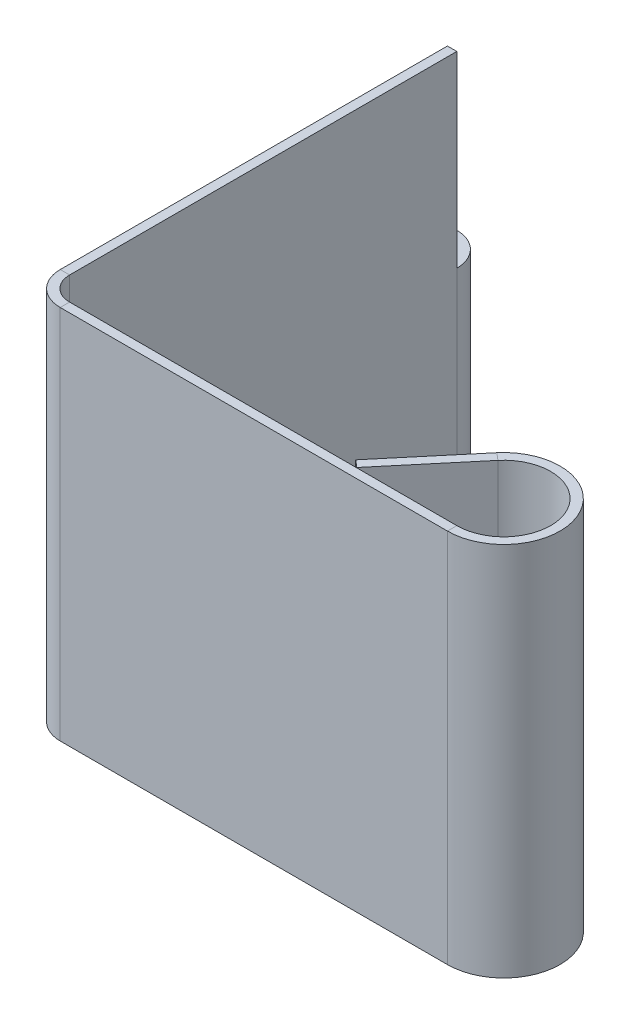
from build123d import *

# Parameters (mm, degrees)
BASE_FLANGE3_DEPTH = 160
EDGE_FLANGE4_DEPTH = 80
HEM1_DEPTH         = 160


# Read off the part's stored shape, not the designer's step: Hem1
# Sheet-metal steps are written as plain solids
with BuildPart() as part:
    # Sketch1 → Base-Flange3 (new body)
    with BuildSketch(Plane(origin=(0, 0, 0), x_dir=(1, 0, 0), z_dir=(0, 1, 0))):
        with BuildLine():
            Line((0, 175), (0, 10))
            ThreePointArc((0, 10), (2.928932188, 2.928932188), (10, 0))
            Line((10, 0), (175, 0))
            Line((175, 0), (175, -4))
            Line((175, -4), (10, -4))
            ThreePointArc((10, -4), (0.100505063, 0.100505063), (-4, 10))
            Line((-4, 10), (-4, 175))
            Line((-4, 175), (0, 175))
        make_face()
    extrude(amount=BASE_FLANGE3_DEPTH)

    # Edge-Flange4 section (across the edge) → Edge-Flange4 (add)
    with BuildSketch(Plane(origin=(-4, 80, -185), x_dir=(0, 0, 1), z_dir=(0, -1, 0))):
        with BuildLine():
            Line((-4, 10), (-4, 46))
            Line((-4, 46), (0, 46))
            Line((0, 46), (0, 10))
            ThreePointArc((0, 10), (2.928932188, 2.928932188), (10, 0))
            Line((10, 0), (10, -4))
            ThreePointArc((10, -4), (0.100505063, 0.100505063), (-4, 10))
        make_face()
    extrude(amount=EDGE_FLANGE4_DEPTH)

    # Hem1 outline → Hem1 (add)
    with BuildSketch(Plane(origin=(0, 0, 0), x_dir=(1, 0, 0), z_dir=(0, 1, 0))):
        with BuildLine():
            Line((129.174241339, 2.724359327), (132.238419112, 0.153208889))
            Line((132.238419112, 0.153208889), (159.679111138, 32.855752194))
            ThreePointArc((159.679111138, 32.855752194), (193.126155741, 28.452365235), (175, 0))
            Line((175, 0), (175, -4))
            ThreePointArc((175, -4), (196.751386889, 30.142838282), (156.614933365, 35.426902632))
            Line((156.614933365, 35.426902632), (129.174241339, 2.724359327))
        make_face()
    extrude(amount=HEM1_DEPTH)


solid = part.part
